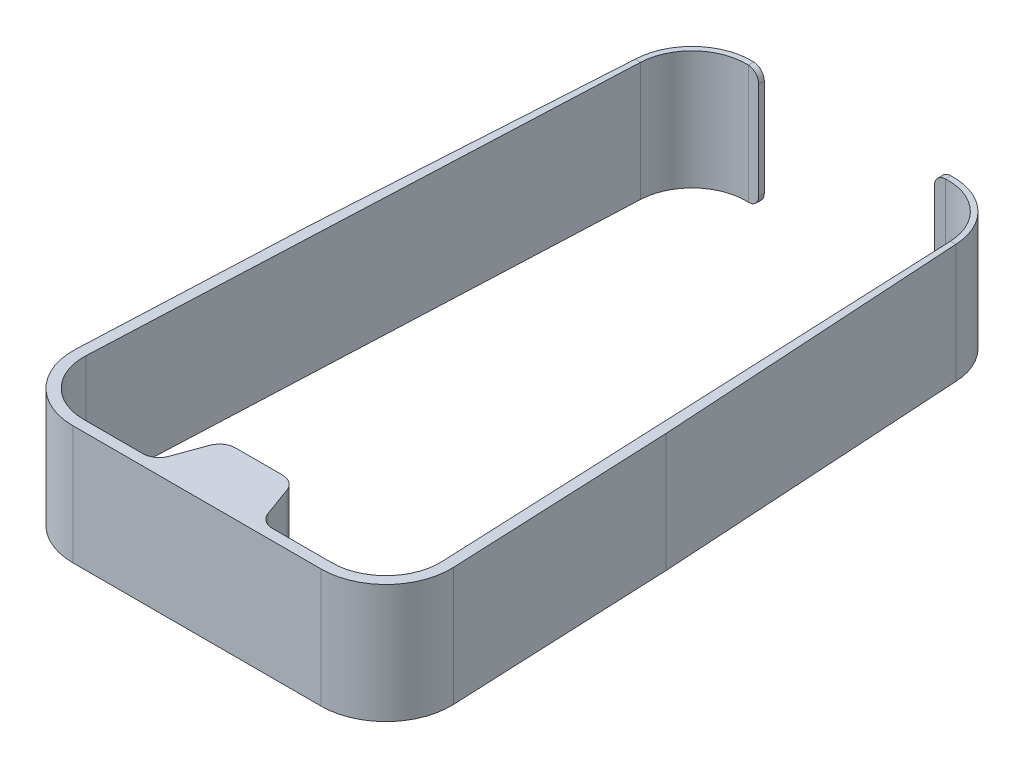
from build123d import *

# Parameters (mm, degrees)
T_LE_DE_BASE_PLI_E1_DEPTH = 22
CONG_1_R                  = 2
BOSS_EXTRU_1_START        = -22
BOSS_EXTRU_1_DEPTH        = 22


# Sheet-metal steps are written as plain solids
with BuildPart() as part:
    # Esquisse1 → Tôle de base pliée1 (new body)
    with BuildSketch(Plane(origin=(0, 0, 0), x_dir=(1, 0, 0), z_dir=(0, 1, 0))):
        with BuildLine():
            Line((-16.269200028, 118.309493267), (-18.267296471, 118.396732042))
            ThreePointArc((-18.267296471, 118.396732042), (-25.459392421, 115.779023194), (-28.69397256, 108.842443699))
            Line((-28.69397256, 108.842443699), (-32.990482216, 10.436193874))
            ThreePointArc((-32.990482216, 10.436193874), (-30.223639621, 3.084869442), (-23, 0))
            Line((-23, 0), (-12, 0))
            ThreePointArc((-12, 0), (-10.279270691, 0.542543867), (-9.180922138, 1.97393957))
            Line((-9.180922138, 1.97393957), (-7.160115408, 7.52606043))
            ThreePointArc((-7.160115408, 7.52606043), (-6.061766854, 8.957456133), (-4.341037545, 9.5))
            Line((-4.341037545, 9.5), (4.341037545, 9.5))
            ThreePointArc((4.341037545, 9.5), (6.061766854, 8.957456133), (7.160115408, 7.52606043))
            Line((7.160115408, 7.52606043), (9.180922138, 1.97393957))
            ThreePointArc((9.180922138, 1.97393957), (10.279270691, 0.542543867), (12, 0))
            Line((12, 0), (23, 0))
            ThreePointArc((23, 0), (30.223639621, 3.084869442), (32.990482216, 10.436193874))
            Line((32.990482216, 10.436193874), (28.69397256, 108.842443699))
            ThreePointArc((28.69397256, 108.842443699), (25.459392421, 115.779023194), (18.267296471, 118.396732042))
            Line((18.267296471, 118.396732042), (16.269200028, 118.309493267))
            Line((16.269200028, 118.309493267), (16.22558064, 119.308541488))
            Line((16.22558064, 119.308541488), (18.223677083, 119.395780263))
            ThreePointArc((18.223677083, 119.395780263), (26.134982628, 116.516300531), (29.693020782, 108.886063087))
            Line((29.693020782, 108.886063087), (33.989530437, 10.479813261))
            ThreePointArc((33.989530437, 10.479813261), (30.946003583, 2.393356386), (23, -1))
            Line((23, -1), (12, -1))
            ThreePointArc((12, -1), (9.705694255, -0.276608177), (8.241229517, 1.631919427))
            Line((8.241229517, 1.631919427), (6.220422787, 7.184040287))
            ThreePointArc((6.220422787, 7.184040287), (5.488190418, 8.138304089), (4.341037545, 8.5))
            Line((4.341037545, 8.5), (-4.341037545, 8.5))
            ThreePointArc((-4.341037545, 8.5), (-5.488190418, 8.138304089), (-6.220422787, 7.184040287))
            Line((-6.220422787, 7.184040287), (-8.241229517, 1.631919427))
            ThreePointArc((-8.241229517, 1.631919427), (-9.705694255, -0.276608177), (-12, -1))
            Line((-12, -1), (-23, -1))
            ThreePointArc((-23, -1), (-30.946003583, 2.393356386), (-33.989530437, 10.479813261))
            Line((-33.989530437, 10.479813261), (-29.693020782, 108.886063087))
            ThreePointArc((-29.693020782, 108.886063087), (-26.134982628, 116.516300531), (-18.223677083, 119.395780263))
            Line((-18.223677083, 119.395780263), (-16.22558064, 119.308541488))
            Line((-16.22558064, 119.308541488), (-16.269200028, 118.309493267))
        make_face()
    extrude(amount=T_LE_DE_BASE_PLI_E1_DEPTH)

    # Congé1
    cong_1_edges = [part.edges().sort_by_distance(p)[0] for p in [
        (16.247390334, 22, -118.809017378),
        (16.247390334, 0, -118.809017378),
        (-16.247390334, 0, -118.809017378),
        (-16.247390334, 22, -118.809017378),
    ]]
    fillet(cong_1_edges, radius=CONG_1_R)

    # Esquisse2 → Boss.-Extru.1 (add)
    with BuildSketch(Plane(origin=(0, 22, 0), x_dir=(1, 0, 0), z_dir=(0, 1, 0)).offset(BOSS_EXTRU_1_START)):
        with BuildLine():
            Line((-29.693020782, 108.886063087), (-33.191022032, 51.694248192))
            Line((-33.191022032, 51.694248192), (-34.988578659, 10.523432648))
            ThreePointArc((-34.988578659, 10.523432648), (-31.668367545, 1.701843331), (-23, -2))
            Line((-23, -2), (23, -2))
            ThreePointArc((23, -2), (31.668367545, 1.701843331), (34.988578659, 10.523432648))
            Line((34.988578659, 10.523432648), (33.191022032, 51.694248192))
            Line((33.191022032, 51.694248192), (29.693020782, 108.886063087))
            Line((29.693020782, 108.886063087), (33.989530437, 10.479813261))
            ThreePointArc((33.989530437, 10.479813261), (30.946003583, 2.393356386), (23, -1))
            Line((23, -1), (12, -1))
            ThreePointArc((12, -1), (9.705694255, -0.276608177), (8.241229517, 1.631919427))
            Line((8.241229517, 1.631919427), (6.220422787, 7.184040287))
            ThreePointArc((6.220422787, 7.184040287), (5.488190418, 8.138304089), (4.341037545, 8.5))
            Line((4.341037545, 8.5), (-4.341037545, 8.5))
            ThreePointArc((-4.341037545, 8.5), (-5.488190418, 8.138304089), (-6.220422787, 7.184040287))
            Line((-6.220422787, 7.184040287), (-8.241229517, 1.631919427))
            ThreePointArc((-8.241229517, 1.631919427), (-9.705694255, -0.276608177), (-12, -1))
            Line((-12, -1), (-23, -1))
            ThreePointArc((-23, -1), (-30.946003583, 2.393356386), (-33.989530437, 10.479813261))
            Line((-33.989530437, 10.479813261), (-29.693020782, 108.886063087))
        make_face()
    extrude(amount=BOSS_EXTRU_1_DEPTH)


solid = part.part
